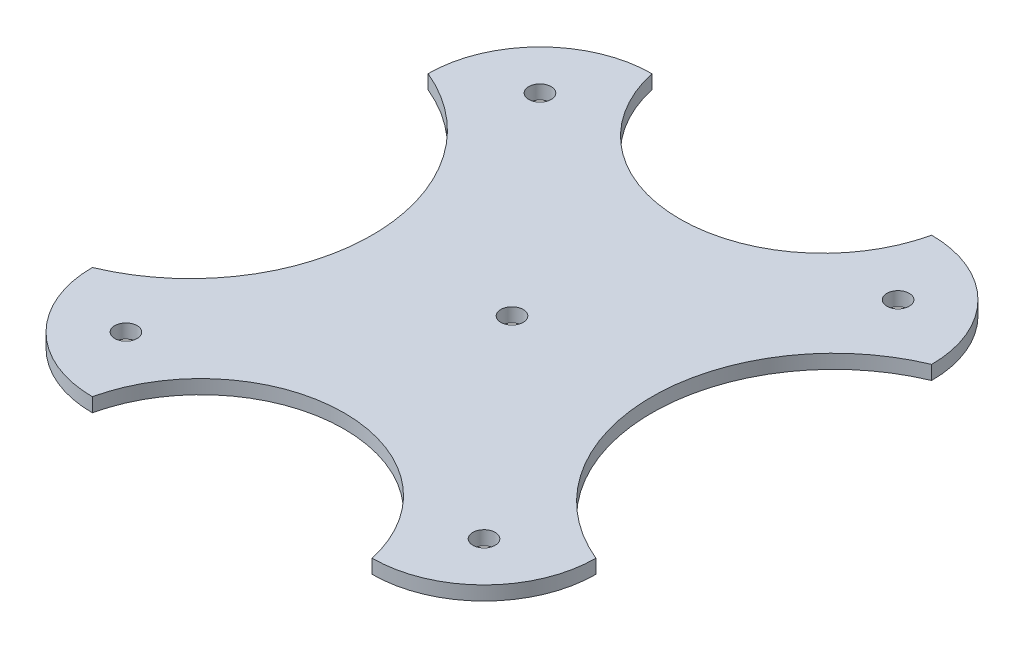
from build123d import *

# Parameters (mm, degrees)
SCHIZZO1_R                   = 4
ESTRUSIONE_ESTRUSIONE1_DEPTH = 5


with BuildPart() as part:
    # Schizzo1 → Estrusione-Estrusione1 (new body)
    with BuildSketch(Plane(origin=(0, 0, 0), x_dir=(1, 0, 0), z_dir=(0, 1, 0))):
        with BuildLine():
            ThreePointArc((12.928879001, 40.259615845), (-15.355392247, 28.543887092), (-27.071120999, 0.259615845))
            ThreePointArc((-27.071120999, 0.259615845), (12.928879001, -59.740384155), (-27.071120999, -119.740384155))
            ThreePointArc((-27.071120999, -119.740384155), (-15.355392247, -148.024655403), (12.928879001, -159.740384155))
            ThreePointArc((12.928879001, -159.740384155), (62.928879001, -119.740384155), (112.928879001, -159.740384155))
            ThreePointArc((112.928879001, -159.740384155), (141.213150248, -148.024655403), (152.928879001, -119.740384155))
            ThreePointArc((152.928879001, -119.740384155), (112.928879001, -59.740384155), (152.928879001, 0.259615845))
            ThreePointArc((152.928879001, 0.259615845), (141.213150248, 28.543887092), (112.928879001, 40.259615845))
            ThreePointArc((112.928879001, 40.259615845), (62.928879001, 0.259615845), (12.928879001, 40.259615845))
        make_face()
        with Locations((-1.071120999, 14.259615845)):
            Circle(SCHIZZO1_R, mode=Mode.SUBTRACT)
        with Locations((126.928879001, 14.259615845)):
            Circle(SCHIZZO1_R, mode=Mode.SUBTRACT)
        with Locations((126.928879001, -133.740384155)):
            Circle(SCHIZZO1_R, mode=Mode.SUBTRACT)
        with Locations((-1.071120999, -133.740384155)):
            Circle(SCHIZZO1_R, mode=Mode.SUBTRACT)
        with Locations((62.928879001, -59.740384155)):
            Circle(SCHIZZO1_R, mode=Mode.SUBTRACT)
    extrude(amount=ESTRUSIONE_ESTRUSIONE1_DEPTH)


solid = part.part
